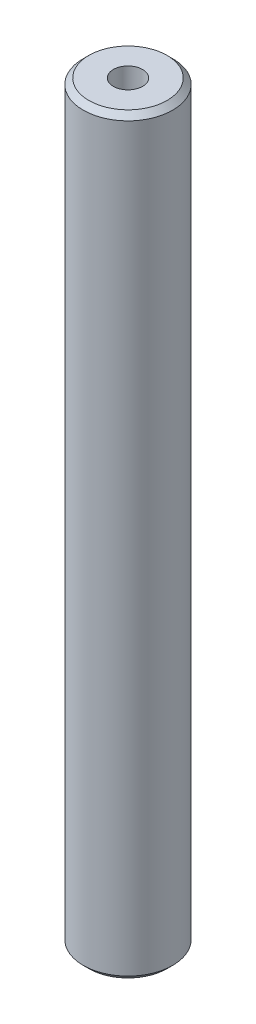
from build123d import *

# Parameters (mm, degrees)
SKETCH1_R           = 22.5
BOSS_EXTRUDE1_DEPTH = 378.421910744
SKETCH2_R           = 7.374808464
CUT_EXTRUDE1_DEPTH  = 380.757346909
CHAMFER1_SIZE       = 2.822136642


with BuildPart() as part:
    # Sketch1 → Boss-Extrude1 (new body)
    with BuildSketch(Plane(origin=(0, 0, 0), x_dir=(1, 0, 0), z_dir=(0, 1, 0))):
        Circle(SKETCH1_R)
    extrude(amount=BOSS_EXTRUDE1_DEPTH)

    # Sketch2 → Cut-Extrude1 (cut, through all)
    with BuildSketch(Plane(origin=(0, 0, 0), x_dir=(1, 0, 0), z_dir=(0, 1, 0))):
        Circle(SKETCH2_R)
    extrude(amount=CUT_EXTRUDE1_DEPTH, mode=Mode.SUBTRACT)

    # Chamfer1
    chamfer1_edges = [part.edges().sort_by_distance(p)[0] for p in [
        (-22.5, 378.421910744, 0),
        (-22.5, 0, 0),
    ]]
    chamfer(chamfer1_edges, length=CHAMFER1_SIZE)


solid = part.part
